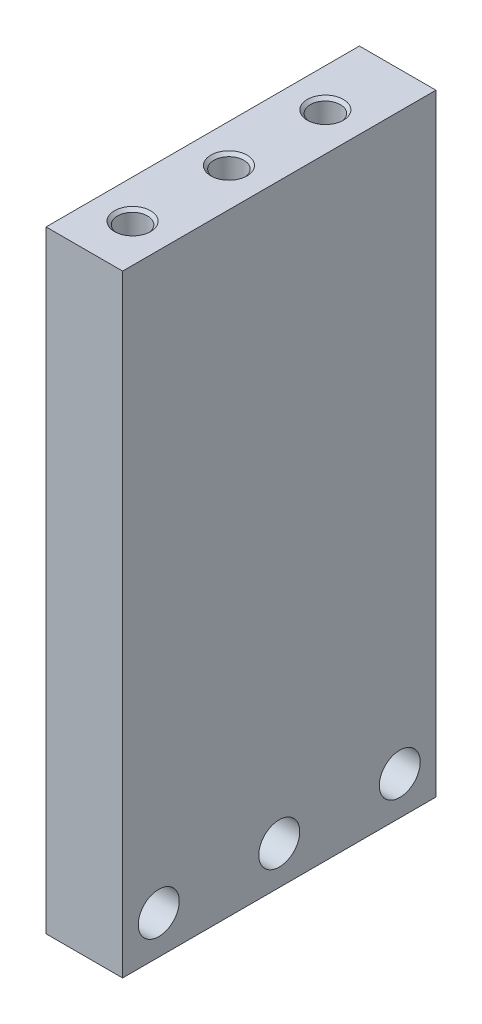
from build123d import *

# Parameters (mm, degrees)
SKETCH1_W           = 6.35
SKETCH1_H           = 50.8
BOSS_EXTRUDE1_DEPTH = 26
SKETCH4_R           = 1.7
CUT_EXTRUDE3_DEPTH  = 6.35
SKETCH14_R          = 1.25
CUT_EXTRUDE13_DEPTH = 5
CHAMFER3_SIZE       = 0.25


with BuildPart() as part:
    # Sketch1 → Boss-Extrude1 (new body)
    with BuildSketch(Plane.XY):
        with Locations((3.175, 25.4)):
            Rectangle(SKETCH1_W, SKETCH1_H)
    extrude(amount=BOSS_EXTRUDE1_DEPTH)

    # Sketch4 → Cut-Extrude3 (cut)
    with BuildSketch(Plane(origin=(6.35, 0, 0), x_dir=(0, 0, -1), z_dir=(1, 0, 0))):
        with Locations((-3, 3.175)):
            Circle(SKETCH4_R)
        with Locations((-23, 3.175)):
            Circle(SKETCH4_R)
        with Locations((-13, 3.175)):
            Circle(SKETCH4_R)
    extrude(amount=-CUT_EXTRUDE3_DEPTH, mode=Mode.SUBTRACT)

    # Sketch14 → Cut-Extrude13 (cut)
    with BuildSketch(Plane(origin=(0, 50.8, 0), x_dir=(1, 0, 0), z_dir=(0, 1, 0))):
        with Locations((3.175, -22)):
            Circle(SKETCH14_R)
        with Locations((3.175, -14)):
            Circle(SKETCH14_R)
        with Locations((3.175, -6)):
            Circle(SKETCH14_R)
    extrude(amount=-CUT_EXTRUDE13_DEPTH, mode=Mode.SUBTRACT)

    # Chamfer3
    chamfer3_edges = [part.edges().sort_by_distance(p)[0] for p in [
        (1.925, 50.8, 22),
        (1.925, 50.8, 14),
        (1.925, 50.8, 6),
    ]]
    chamfer(chamfer3_edges, length=CHAMFER3_SIZE)


solid = part.part
